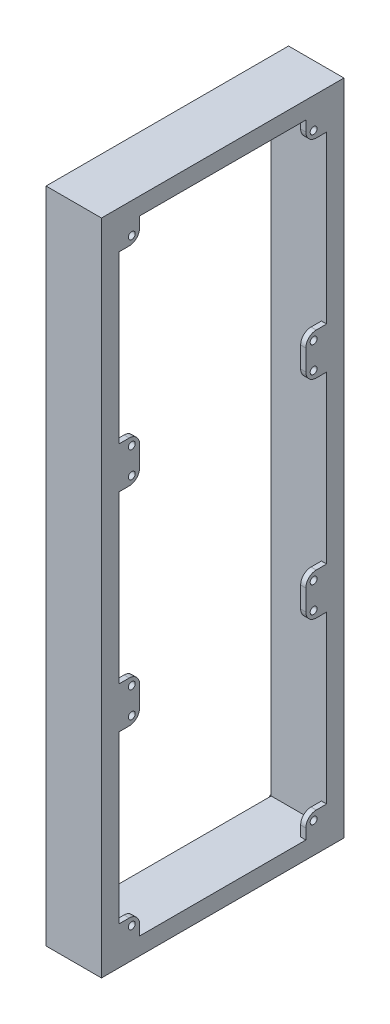
from build123d import *

# Parameters (mm, degrees)
SKETCH1_W                        = 380
SKETCH1_H                        = 140
SKETCH1_W_2                      = 360
SKETCH1_H_2                      = 120
SKETCH1_R                        = 2
BOSS_EXTRUDE2_DEPTH              = 3
SKETCH1_6_W                      = 380
SKETCH1_6_H                      = 140
SKETCH1_6_W_2                    = 360
SKETCH1_6_H_2                    = 120
BOSS_EXTRUDE5_DEPTH              = 29
SKETCH14_W                       = 378
SKETCH14_H                       = 138
SKETCH14_W_2                     = 377.2
SKETCH14_H_2                     = 137.2
BOSS_EXTRUDE7_DEPTH              = 0.2
SKETCH14_4_R                     = 3.95
BOSS_EXTRUDE9_DEPTH              = 0.8
MOUNTING_MAGNET_HOLES_DEPTH      = 0.6
MOUNTING_MAGNET_HOLES_DEPTH_BACK = 1.5
SKETCH14_5_R                     = 3.15
SKETCH17_W                       = 378.4
SKETCH17_H                       = 138.4
SKETCH17_W_2                     = 377.2
SKETCH17_H_2                     = 137.2
BOSS_EXTRUDE10_DEPTH             = 0.4
CHAMFER1_SIZE                    = 0.4
CHAMFER1_SIZE_2                  = 0.230940108
COVER_START                      = -0.4
SKETCH18_R                       = 3.15
COVER_MAGNET_HOLES_DEPTH         = 2.1


with BuildPart() as part:
    # Sketch1 → Boss-Extrude2 (new body)
    # profile 1 of 13: a face of its own
    with BuildSketch(Plane.YZ):
        Rectangle(SKETCH1_W, SKETCH1_H)
        Rectangle(SKETCH1_W_2, SKETCH1_H_2, mode=Mode.SUBTRACT)
    # profile 2 of 13: a face of its own
    with BuildSketch(Plane.YZ):
        with BuildLine():
            Line((-180, 60), (-180, 48))
            Line((-180, 48), (-174, 48))
            ThreePointArc((-174, 48), (-169.757359313, 49.757359313), (-168, 54))
            Line((-168, 54), (-168, 60))
            Line((-168, 60), (-180, 60))
        make_face()
        with Locations(Location((-172.5, 52.5, 0), (0, 0, 270))):
            Circle(SKETCH1_R, mode=Mode.SUBTRACT)
    # profile 3 of 13: a face of its own
    with BuildSketch(Plane.YZ):
        with BuildLine():
            Line((-60, 60), (-72, 60))
            Line((-72, 60), (-72, 54))
            ThreePointArc((-72, 54), (-70.242640687, 49.757359313), (-66, 48))
            Line((-66, 48), (-60, 48))
            Line((-60, 48), (-60, 60))
        make_face()
        with Locations(Location((-67.5, 52.5, 0), (0, 0, 270))):
            Circle(SKETCH1_R, mode=Mode.SUBTRACT)
    # profile 4 of 13: a face of its own
    with BuildSketch(Plane.YZ):
        with BuildLine():
            Line((-48, 60), (-60, 60))
            Line((-60, 60), (-60, 48))
            Line((-60, 48), (-54, 48))
            ThreePointArc((-54, 48), (-49.757359313, 49.757359313), (-48, 54))
            Line((-48, 54), (-48, 60))
        make_face()
        with Locations(Location((-52.5, 52.5, 0), (0, 0, 270))):
            Circle(SKETCH1_R, mode=Mode.SUBTRACT)
    # profile 5 of 13: a face of its own
    with BuildSketch(Plane.YZ):
        with BuildLine():
            Line((-60, -48), (-60, -60))
            Line((-60, -60), (-48, -60))
            Line((-48, -60), (-48, -54))
            ThreePointArc((-48, -54), (-49.757359313, -49.757359313), (-54, -48))
            Line((-54, -48), (-60, -48))
        make_face()
        with Locations(Location((-52.5, -52.5, 0), (0, 0, 270))):
            Circle(SKETCH1_R, mode=Mode.SUBTRACT)
    # profile 6 of 13: a face of its own
    with BuildSketch(Plane.YZ):
        with BuildLine():
            Line((-72, -54), (-72, -60))
            Line((-72, -60), (-60, -60))
            Line((-60, -60), (-60, -48))
            Line((-60, -48), (-66, -48))
            ThreePointArc((-66, -48), (-70.242640687, -49.757359313), (-72, -54))
        make_face()
        with Locations(Location((-67.5, -52.5, 0), (0, 0, 270))):
            Circle(SKETCH1_R, mode=Mode.SUBTRACT)
    # profile 7 of 13: a face of its own
    with BuildSketch(Plane.YZ):
        with BuildLine():
            Line((-180, -48), (-180, -60))
            Line((-180, -60), (-168, -60))
            Line((-168, -60), (-168, -54))
            ThreePointArc((-168, -54), (-169.757359313, -49.757359313), (-174, -48))
            Line((-174, -48), (-180, -48))
        make_face()
        with Locations(Location((-172.5, -52.5, 0), (0, 0, 270))):
            Circle(SKETCH1_R, mode=Mode.SUBTRACT)
    # profile 8 of 13: a face of its own
    with BuildSketch(Plane.YZ):
        with BuildLine():
            Line((48, -54), (48, -60))
            Line((48, -60), (60, -60))
            Line((60, -60), (60, -48))
            Line((60, -48), (54, -48))
            ThreePointArc((54, -48), (49.757359313, -49.757359313), (48, -54))
        make_face()
        with Locations(Location((52.5, -52.5, 0), (0, 0, 270))):
            Circle(SKETCH1_R, mode=Mode.SUBTRACT)
    # profile 9 of 13: a face of its own
    with BuildSketch(Plane.YZ):
        with BuildLine():
            Line((60, -48), (60, -60))
            Line((60, -60), (72, -60))
            Line((72, -60), (72, -54))
            ThreePointArc((72, -54), (70.242640687, -49.757359313), (66, -48))
            Line((66, -48), (60, -48))
        make_face()
        with Locations(Location((67.5, -52.5, 0), (0, 0, 270))):
            Circle(SKETCH1_R, mode=Mode.SUBTRACT)
    # profile 10 of 13: a face of its own
    with BuildSketch(Plane.YZ):
        with BuildLine():
            Line((72, 60), (60, 60))
            Line((60, 60), (60, 48))
            Line((60, 48), (66, 48))
            ThreePointArc((66, 48), (70.242640687, 49.757359313), (72, 54))
            Line((72, 54), (72, 60))
        make_face()
        with Locations(Location((67.5, 52.5, 0), (0, 0, 270))):
            Circle(SKETCH1_R, mode=Mode.SUBTRACT)
    # profile 11 of 13: a face of its own
    with BuildSketch(Plane.YZ):
        with BuildLine():
            Line((60, 60), (48, 60))
            Line((48, 60), (48, 54))
            ThreePointArc((48, 54), (49.757359313, 49.757359313), (54, 48))
            Line((54, 48), (60, 48))
            Line((60, 48), (60, 60))
        make_face()
        with Locations(Location((52.5, 52.5, 0), (0, 0, 270))):
            Circle(SKETCH1_R, mode=Mode.SUBTRACT)
    # profile 12 of 13: a face of its own
    with BuildSketch(Plane.YZ):
        with BuildLine():
            Line((174, 48), (180, 48))
            Line((180, 48), (180, 60))
            Line((180, 60), (168, 60))
            Line((168, 60), (168, 54))
            ThreePointArc((168, 54), (169.757359313, 49.757359313), (174, 48))
        make_face()
        with Locations(Location((172.5, 52.5, 0), (0, 0, 270))):
            Circle(SKETCH1_R, mode=Mode.SUBTRACT)
    # profile 13 of 13: a face of its own
    with BuildSketch(Plane.YZ):
        with BuildLine():
            Line((168, -54), (168, -60))
            Line((168, -60), (180, -60))
            Line((180, -60), (180, -48))
            Line((180, -48), (174, -48))
            ThreePointArc((174, -48), (169.757359313, -49.757359313), (168, -54))
        make_face()
        with Locations(Location((172.5, -52.5, 0), (0, 0, 270))):
            Circle(SKETCH1_R, mode=Mode.SUBTRACT)
    extrude(amount=BOSS_EXTRUDE2_DEPTH)

    # Sketch1<6> → Boss-Extrude5 (add)
    with BuildSketch(Plane.YZ):
        Rectangle(SKETCH1_6_W, SKETCH1_6_H)
        Rectangle(SKETCH1_6_W_2, SKETCH1_6_H_2, mode=Mode.SUBTRACT)
    extrude(amount=-BOSS_EXTRUDE5_DEPTH)

    # Sketch14 → Boss-Extrude7 (add)
    with BuildSketch(Plane(origin=(-29, 0, 0), x_dir=(0, -1, 0), z_dir=(-1, 0, 0))):
        Rectangle(SKETCH14_W, SKETCH14_H)
        Rectangle(SKETCH14_W_2, SKETCH14_H_2, mode=Mode.SUBTRACT)
    extrude(amount=BOSS_EXTRUDE7_DEPTH)

    # Sketch14<4> → Boss-Extrude9 (add)
    with BuildSketch(Plane(origin=(-29, 0, 0), x_dir=(0, -1, 0), z_dir=(-1, 0, 0))):
        with Locations(Location((-182.928932188, 62.928932188, 0), (0, 0, 270))):
            Circle(SKETCH14_4_R)
        with Locations(Location((182.928932188, 62.928932188, 0), (0, 0, 270))):
            Circle(SKETCH14_4_R)
        with Locations(Location((182.928932188, -62.928932188, 0), (0, 0, 270))):
            Circle(SKETCH14_4_R)
        with Locations(Location((-182.928932188, -62.928932188, 0), (0, 0, 270))):
            Circle(SKETCH14_4_R)
    extrude(amount=BOSS_EXTRUDE9_DEPTH)

    # Sketch14<5> → Mounting magnet holes (cut, two sides: drawn at the far end of the back side and taken through both)
    with BuildSketch(Plane(origin=(-29, 0, 0), x_dir=(0, -1, 0), z_dir=(-1, 0, 0)).offset(-MOUNTING_MAGNET_HOLES_DEPTH_BACK)):
        with Locations(Location((-182.928932188, 62.928932188, 0), (0, 0, 90))):
            Circle(SKETCH14_5_R)
        with Locations(Location((182.928932188, 62.928932188, 0), (0, 0, 270))):
            Circle(SKETCH14_5_R)
        with Locations(Location((182.928932188, -62.928932188, 0), (0, 0, 90))):
            Circle(SKETCH14_5_R)
        with Locations(Location((-182.928932188, -62.928932188, 0), (0, 0, 270))):
            Circle(SKETCH14_5_R)
    extrude(amount=MOUNTING_MAGNET_HOLES_DEPTH + MOUNTING_MAGNET_HOLES_DEPTH_BACK, mode=Mode.SUBTRACT)

    # Sketch17 → Boss-Extrude10 (add)
    with BuildSketch(Plane(origin=(-29.2, 0, 0), x_dir=(0, -1, 0), z_dir=(-1, 0, 0))):
        Rectangle(SKETCH17_W, SKETCH17_H)
        Rectangle(SKETCH17_W_2, SKETCH17_H_2, mode=Mode.SUBTRACT)
    extrude(amount=BOSS_EXTRUDE10_DEPTH)

    # Chamfer1
    # the kernel refuses this chamfer: 0.4, 0.230940108 mm, written as the material it takes off along each edge
    with BuildSketch(Plane(origin=(-29.6, 190.234834302, -69.2), x_dir=(0.9998132206222082, 0, -0.01932676561269006), z_dir=(0, -1, 0))) as chamfer1_piece_1:
        Polygon((CHAMFER1_SIZE * 0.999813220622, CHAMFER1_SIZE * 0.0193267656127), (-CHAMFER1_SIZE_2 * 0.0193267655856, CHAMFER1_SIZE_2 * 0.999813219219), (0, 0), align=None)
    extrude(amount=380.469668604, mode=Mode.SUBTRACT)
    with BuildSketch(Plane(origin=(-29.6, -189.2, -70.234834302), x_dir=(-0.057893862402669215, 0.9983227437537926, 0), z_dir=(0, 0, 1)), Plane(origin=(-29.6, 189.2, 70.234834302), x_dir=(-0.057893862402669215, -0.9983227437537926, 0), z_dir=(0, 0, -1))) as chamfer1_piece_2:
        Polygon((CHAMFER1_SIZE_2 * 0.998322742353, -CHAMFER1_SIZE_2 * 0.0578938623214), (-CHAMFER1_SIZE * 0.0578938624027, -CHAMFER1_SIZE * 0.998322743754), (0, 0), align=None)
    extrude(amount=140.469668604, mode=Mode.SUBTRACT)
    with BuildSketch(Plane(origin=(-29.6, -190.234834302, 69.2), x_dir=(-0.057893862402672656, 0, -0.9983227437537925), z_dir=(0, 1, 0))) as chamfer1_piece_3:
        Polygon((CHAMFER1_SIZE_2 * 0.998322742353, -CHAMFER1_SIZE_2 * 0.0578938623214), (-CHAMFER1_SIZE * 0.0578938624027, -CHAMFER1_SIZE * 0.998322743754), (0, 0), align=None)
    extrude(amount=380.469668604, mode=Mode.SUBTRACT)

    # Sketch18 → Cover magnet holes (cut)
    with BuildSketch(Plane.YZ.offset(3).offset(COVER_START)):
        with Locations(Location((-185, 65, 0), (0, 0, 270))):
            Circle(SKETCH18_R)
        with Locations(Location((185, 65, 0), (0, 0, 90))):
            Circle(SKETCH18_R)
        with Locations(Location((185, -65, 0), (0, 0, 270))):
            Circle(SKETCH18_R)
        with Locations(Location((-185, -65, 0), (0, 0, 90))):
            Circle(SKETCH18_R)
    extrude(amount=-COVER_MAGNET_HOLES_DEPTH, mode=Mode.SUBTRACT)


solid = part.part
